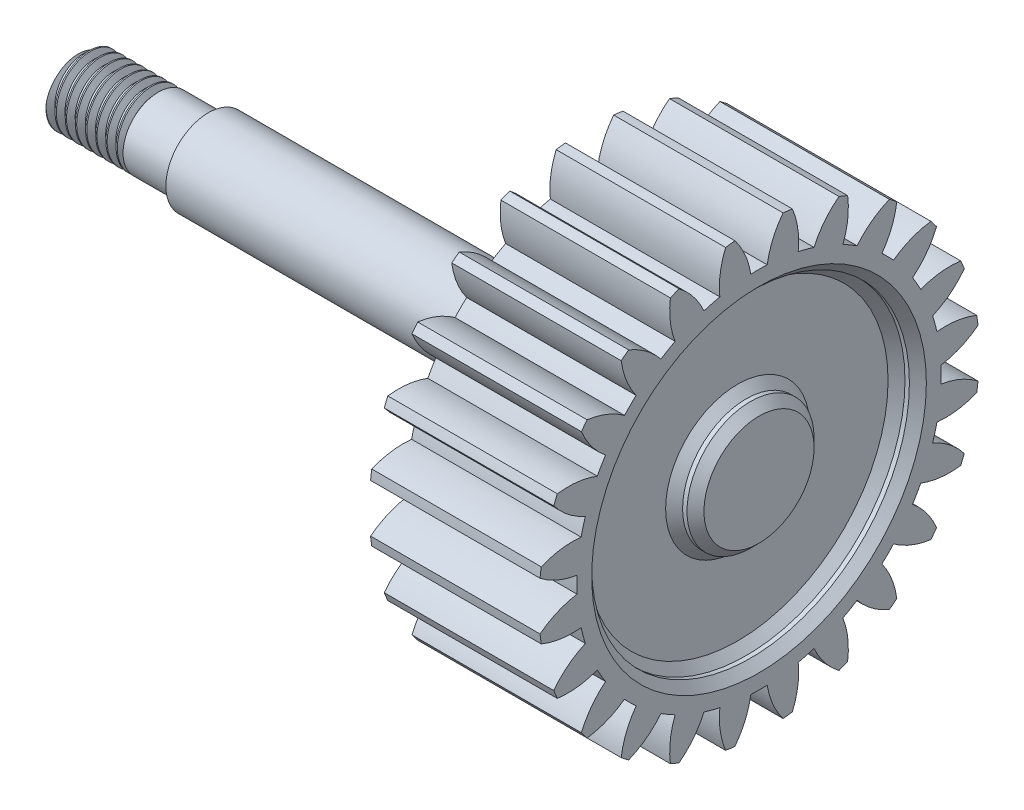
from build123d import *

# Parameters (mm, degrees)
SKETCH1_W                         = 10
SKETCH1_H                         = 13
CUT_EXTRUDE1_DEPTH                = 24.918025574
CUT_EXTRUDE2_DEPTH                = 24.918025574
CUT_EXTRUDE3_DEPTH                = 24.918025574
CUT_EXTRUDE4_DEPTH                = 24.918025574
CUT_EXTRUDE5_DEPTH                = 24.918025574
CUT_EXTRUDE6_DEPTH                = 24.918025574
CUT_EXTRUDE7_DEPTH                = 24.918025574
CUT_EXTRUDE8_DEPTH                = 24.918025574
CUT_EXTRUDE9_DEPTH                = 24.918025574
CUT_EXTRUDE10_DEPTH               = 24.918025574
CUT_EXTRUDE11_DEPTH               = 24.918025574
CUT_EXTRUDE12_DEPTH               = 24.918025574
CUT_EXTRUDE13_DEPTH               = 24.918025574
CUT_EXTRUDE14_DEPTH               = 24.868127435
CUT_EXTRUDE15_DEPTH               = 24.868127435
CUT_EXTRUDE16_DEPTH               = 24.868127435
CUT_EXTRUDE17_DEPTH               = 24.868127435
CUT_EXTRUDE18_DEPTH               = 24.868127435
CUT_EXTRUDE19_DEPTH               = 24.868127435
CUT_EXTRUDE20_DEPTH               = 24.817762377
CUT_EXTRUDE21_DEPTH               = 24.817762377
CUT_EXTRUDE22_DEPTH               = 24.817762377
CUT_EXTRUDE23_DEPTH               = 24.817762377
CUT_EXTRUDE24_DEPTH               = 24.817762377
TAP_DRILL_FOR_M18_HELICOIL1_D     = 18.75
TAP_DRILL_FOR_M18_HELICOIL1_DEPTH = 1.260067876
SKETCH28_W                        = 1.260067876
SKETCH28_H                        = 3.75
SKETCH29_W                        = 30.0000508
SKETCH29_H                        = 2.5
F_0_8_0_8_DIAMETER_HOLE1_D        = 0.8
BOSS_EXTRUDE1_START               = -40.0000508
SKETCH33_R                        = 0.4
BOSS_EXTRUDE1_DEPTH               = 40.0000508
SKETCH35_R                        = 9.375
SKETCH35_R_2                      = 3.75
CUT_EXTRUDE26_DEPTH               = 1.5
CHAMFER1_SIZE                     = 0.5
SKETCH38_R                        = 2.5
SKETCH38_R_2                      = 1.75
CUT_EXTRUDE_THIN1_DEPTH           = 7.5
THREAD1_PITCH                     = 0.6
BOSS_EXTRUDE2_START               = 2.95
SKETCH43_R                        = 2.075
SKETCH43_R_2                      = 1.75
BOSS_EXTRUDE2_DEPTH               = 2.95
CUT_EXTRUDE28_DEPTH               = 1


with BuildPart() as part:
    # Sketch1 → Revolve1 (revolve)
    with BuildSketch(Plane(origin=(0, 0, -2.308091591), x_dir=(-1, 0, 0), z_dir=(0, 0, -1)), mode=Mode.PRIVATE) as revolve1_sk:
        with Locations((-16.260067876, 8.918634156)):
            Rectangle(SKETCH1_W, SKETCH1_H)
    revolve(revolve1_sk.sketch.rotate(Axis((21.260067876, 2.418634156, -2.308091591), (-1, 0, 0)), 270), axis=Axis((21.260067876, 2.418634156, -2.308091591), (-1, 0, 0)))

    # Sketch2 → Cut-Extrude1 (cut, through all)
    with BuildSketch(Plane.ZY.offset(-11.260067876)):
        with BuildLine():
            ThreePointArc((10.613827588, 0.995958952), (10.691908409, 2.418634156), (10.613827588, 3.841309359))
            ThreePointArc((10.613827588, 3.841309359), (9.580993275, 3.234366374), (8.430031088, 2.90208254))
            ThreePointArc((8.430031088, 2.90208254), (8.440908409, 2.418634156), (8.430031088, 1.935185771))
            ThreePointArc((8.430031088, 1.935185771), (9.580993275, 1.602901937), (10.613827588, 0.995958952))
        make_face()
    extrude(amount=-CUT_EXTRUDE1_DEPTH, mode=Mode.SUBTRACT)

    # Sketch3 → Cut-Extrude2 (cut, through all)
    with BuildSketch(Plane.ZY.offset(-11.260067876)):
        with BuildLine():
            ThreePointArc((9.805308431, -2.300003349), (10.248944151, -0.946013431), (10.541739307, 0.448394095))
            ThreePointArc((10.541739307, 0.448394095), (9.387009566, 0.129449381), (8.189264079, 0.106378778))
            ThreePointArc((8.189264079, 0.106378778), (8.074645116, -0.36341176), (7.939012781, -0.827571782))
            ThreePointArc((7.939012781, -0.827571782), (8.964755498, -1.446424254), (9.805308431, -2.300003349))
        make_face()
    extrude(amount=-CUT_EXTRUDE2_DEPTH, mode=Mode.SUBTRACT)

    # Sketch4 → Cut-Extrude3 (cut, through all)
    with BuildSketch(Plane.ZY.offset(-11.260067876)):
        with BuildLine():
            ThreePointArc((8.171281082, -5.274398302), (8.950238658, -4.081365844), (9.593956286, -2.810252566))
            ThreePointArc((9.593956286, -2.810252566), (8.39602404, -2.819463453), (7.23311963, -2.531748602))
            ThreePointArc((7.23311963, -2.531748602), (7.000815474, -2.955865844), (6.749671245, -3.369105766))
            ThreePointArc((6.749671245, -3.369105766), (7.580291822, -4.232353102), (8.171281082, -5.274398302))
        make_face()
    extrude(amount=-CUT_EXTRUDE3_DEPTH, mode=Mode.SUBTRACT)

    # Sketch5 → Cut-Extrude4 (cut, through all)
    with BuildSketch(Plane.ZY.offset(-11.260067876)):
        with BuildLine():
            ThreePointArc((5.823101802, -7.724525806), (6.884296565, -6.773754), (7.83506837, -5.712559238))
            ThreePointArc((7.83506837, -5.712559238), (6.675570724, -5.411408592), (5.626757403, -4.832515577))
            ThreePointArc((5.626757403, -4.832515577), (5.2925992, -5.182056635), (4.943058141, -5.516214839))
            ThreePointArc((4.943058141, -5.516214839), (5.521951157, -6.565028159), (5.823101802, -7.724525806))
        make_face()
    extrude(amount=-CUT_EXTRUDE4_DEPTH, mode=Mode.SUBTRACT)

    # Sketch6 → Cut-Extrude5 (cut, through all)
    with BuildSketch(Plane.ZY.offset(-11.260067876)):
        with BuildLine():
            ThreePointArc((2.920795131, -9.483413721), (4.191908409, -8.839696094), (5.384940866, -8.060738517))
            ThreePointArc((5.384940866, -8.060738517), (4.342895666, -7.469749257), (3.479648331, -6.639128681))
            ThreePointArc((3.479648331, -6.639128681), (3.066408409, -6.89027291), (2.642291166, -7.122577065))
            ThreePointArc((2.642291166, -7.122577065), (2.930006018, -8.285481476), (2.920795131, -9.483413721))
        make_face()
    extrude(amount=-CUT_EXTRUDE5_DEPTH, mode=Mode.SUBTRACT)

    # Sketch7 → Cut-Extrude6 (cut, through all)
    with BuildSketch(Plane.ZY.offset(-11.260067876)):
        with BuildLine():
            ThreePointArc((-0.33785153, -10.431196742), (1.056555995, -10.138401586), (2.410545914, -9.694765867))
            ThreePointArc((2.410545914, -9.694765867), (1.556966819, -8.854212934), (0.938114347, -7.828470216))
            ThreePointArc((0.938114347, -7.828470216), (0.473954325, -7.964102551), (0.004163787, -8.078721515))
            ThreePointArc((0.004163787, -8.078721515), (-0.018906816, -9.276467002), (-0.33785153, -10.431196742))
        make_face()
    extrude(amount=-CUT_EXTRUDE6_DEPTH, mode=Mode.SUBTRACT)

    # Sketch8 → Cut-Extrude7 (cut, through all)
    with BuildSketch(Plane.ZY.offset(-11.260067876)):
        with BuildLine():
            ThreePointArc((-3.730766795, -10.503285023), (-2.308091591, -10.581365844), (-0.885416387, -10.503285023))
            ThreePointArc((-0.885416387, -10.503285023), (-1.492359372, -9.470450711), (-1.824643207, -8.319488523))
            ThreePointArc((-1.824643207, -8.319488523), (-2.308091591, -8.330365844), (-2.791539975, -8.319488523))
            ThreePointArc((-2.791539975, -8.319488523), (-3.12382381, -9.470450711), (-3.730766795, -10.503285023))
        make_face()
    extrude(amount=-CUT_EXTRUDE7_DEPTH, mode=Mode.SUBTRACT)

    # Sketch9 → Cut-Extrude8 (cut, through all)
    with BuildSketch(Plane.ZY.offset(-11.260067876)):
        with BuildLine():
            ThreePointArc((-7.026729096, -9.694765867), (-5.672739177, -10.138401586), (-4.278331652, -10.431196742))
            ThreePointArc((-4.278331652, -10.431196742), (-4.597276366, -9.276467002), (-4.620346969, -8.078721515))
            ThreePointArc((-4.620346969, -8.078721515), (-5.090137507, -7.964102551), (-5.554297529, -7.828470216))
            ThreePointArc((-5.554297529, -7.828470216), (-6.173150001, -8.854212934), (-7.026729096, -9.694765867))
        make_face()
    extrude(amount=-CUT_EXTRUDE8_DEPTH, mode=Mode.SUBTRACT)

    # Sketch10 → Cut-Extrude9 (cut, through all)
    with BuildSketch(Plane.ZY.offset(-11.260067876)):
        with BuildLine():
            ThreePointArc((-10.001124048, -8.060738517), (-8.808091591, -8.839696094), (-7.536978312, -9.483413721))
            ThreePointArc((-7.536978312, -9.483413721), (-7.5461892, -8.285481476), (-7.258474348, -7.122577065))
            ThreePointArc((-7.258474348, -7.122577065), (-7.682591591, -6.89027291), (-8.095831512, -6.639128681))
            ThreePointArc((-8.095831512, -6.639128681), (-8.959078848, -7.469749257), (-10.001124048, -8.060738517))
        make_face()
    extrude(amount=-CUT_EXTRUDE9_DEPTH, mode=Mode.SUBTRACT)

    # Sketch11 → Cut-Extrude10 (cut, through all)
    with BuildSketch(Plane.ZY.offset(-11.260067876)):
        with BuildLine():
            ThreePointArc((-12.451251552, -5.712559238), (-11.500479746, -6.773754), (-10.439284984, -7.724525806))
            ThreePointArc((-10.439284984, -7.724525806), (-10.138134338, -6.565028159), (-9.559241323, -5.516214839))
            ThreePointArc((-9.559241323, -5.516214839), (-9.908782382, -5.182056635), (-10.242940585, -4.832515577))
            ThreePointArc((-10.242940585, -4.832515577), (-11.291753906, -5.411408592), (-12.451251552, -5.712559238))
        make_face()
    extrude(amount=-CUT_EXTRUDE10_DEPTH, mode=Mode.SUBTRACT)

    # Sketch12 → Cut-Extrude11 (cut, through all)
    with BuildSketch(Plane.ZY.offset(-11.260067876)):
        with BuildLine():
            ThreePointArc((-14.210139467, -2.810252566), (-13.56642184, -4.081365844), (-12.787464263, -5.274398302))
            ThreePointArc((-12.787464263, -5.274398302), (-12.196475003, -4.232353102), (-11.365854427, -3.369105766))
            ThreePointArc((-11.365854427, -3.369105766), (-11.616998656, -2.955865844), (-11.849302812, -2.531748602))
            ThreePointArc((-11.849302812, -2.531748602), (-13.012207222, -2.819463453), (-14.210139467, -2.810252566))
        make_face()
    extrude(amount=-CUT_EXTRUDE11_DEPTH, mode=Mode.SUBTRACT)

    # Sketch13 → Cut-Extrude12 (cut, through all)
    with BuildSketch(Plane.ZY.offset(-11.260067876)):
        with BuildLine():
            ThreePointArc((-15.157922489, 0.448394095), (-14.865127333, -0.946013431), (-14.421491613, -2.300003349))
            ThreePointArc((-14.421491613, -2.300003349), (-13.58093868, -1.446424254), (-12.555195963, -0.827571782))
            ThreePointArc((-12.555195963, -0.827571782), (-12.690828298, -0.36341176), (-12.805447261, 0.106378778))
            ThreePointArc((-12.805447261, 0.106378778), (-14.003192748, 0.129449381), (-15.157922489, 0.448394095))
        make_face()
    extrude(amount=-CUT_EXTRUDE12_DEPTH, mode=Mode.SUBTRACT)

    # Sketch14 → Cut-Extrude13 (cut, through all)
    with BuildSketch(Plane.ZY.offset(-11.260067876)):
        with BuildLine():
            ThreePointArc((-15.23001077, 3.841309359), (-15.308091591, 2.418634156), (-15.23001077, 0.995958952))
            ThreePointArc((-15.23001077, 0.995958952), (-14.197176457, 1.602901937), (-13.046214269, 1.935185771))
            ThreePointArc((-13.046214269, 1.935185771), (-13.057091591, 2.418634156), (-13.046214269, 2.90208254))
            ThreePointArc((-13.046214269, 2.90208254), (-14.197176457, 3.234366374), (-15.23001077, 3.841309359))
        make_face()
    extrude(amount=-CUT_EXTRUDE13_DEPTH, mode=Mode.SUBTRACT)

    # Sketch15 → Cut-Extrude14 (cut, through all)
    with BuildSketch(Plane.ZY.offset(-11.260067876)):
        with BuildLine():
            ThreePointArc((-14.421491613, 7.13727166), (-14.865127333, 5.783281742), (-15.157922489, 4.388874216))
            ThreePointArc((-15.157922489, 4.388874216), (-14.003192748, 4.70781893), (-12.805447261, 4.730889533))
            ThreePointArc((-12.805447261, 4.730889533), (-12.690828298, 5.200680071), (-12.555195963, 5.664840093))
            ThreePointArc((-12.555195963, 5.664840093), (-13.58093868, 6.283692565), (-14.421491613, 7.13727166))
        make_face()
    extrude(amount=-CUT_EXTRUDE14_DEPTH, mode=Mode.SUBTRACT)

    # Sketch16 → Cut-Extrude15 (cut, through all)
    with BuildSketch(Plane.ZY.offset(-11.260067876)):
        with BuildLine():
            ThreePointArc((-12.787464263, 10.111666613), (-13.56642184, 8.918634156), (-14.210139467, 7.647520877))
            ThreePointArc((-14.210139467, 7.647520877), (-13.012207222, 7.656731764), (-11.849302812, 7.369016913))
            ThreePointArc((-11.849302812, 7.369016913), (-11.616998656, 7.793134156), (-11.365854427, 8.206374077))
            ThreePointArc((-11.365854427, 8.206374077), (-12.196475003, 9.069621413), (-12.787464263, 10.111666613))
        make_face()
    extrude(amount=-CUT_EXTRUDE15_DEPTH, mode=Mode.SUBTRACT)

    # Sketch17 → Cut-Extrude16 (cut, through all)
    with BuildSketch(Plane.ZY.offset(-11.260067876)):
        with BuildLine():
            ThreePointArc((-10.439284984, 12.561794117), (-11.500479746, 11.611022311), (-12.451251552, 10.549827549))
            ThreePointArc((-12.451251552, 10.549827549), (-11.291753906, 10.248676903), (-10.242940585, 9.669783888))
            ThreePointArc((-10.242940585, 9.669783888), (-9.908782382, 10.019324946), (-9.559241323, 10.35348315))
            ThreePointArc((-9.559241323, 10.35348315), (-10.138134338, 11.40229647), (-10.439284984, 12.561794117))
        make_face()
    extrude(amount=-CUT_EXTRUDE16_DEPTH, mode=Mode.SUBTRACT)

    # Sketch18 → Cut-Extrude17 (cut, through all)
    with BuildSketch(Plane.ZY.offset(-11.260067876)):
        with BuildLine():
            ThreePointArc((-7.536978312, 14.320682032), (-8.808091591, 13.676964405), (-10.001124048, 12.898006828))
            ThreePointArc((-10.001124048, 12.898006828), (-8.959078848, 12.307017568), (-8.095831512, 11.476396992))
            ThreePointArc((-8.095831512, 11.476396992), (-7.682591591, 11.727541221), (-7.258474348, 11.959845376))
            ThreePointArc((-7.258474348, 11.959845376), (-7.5461892, 13.122749787), (-7.536978312, 14.320682032))
        make_face()
    extrude(amount=-CUT_EXTRUDE17_DEPTH, mode=Mode.SUBTRACT)

    # Sketch19 → Cut-Extrude18 (cut, through all)
    with BuildSketch(Plane.ZY.offset(-11.260067876)):
        with BuildLine():
            ThreePointArc((-4.278331652, 15.268465053), (-5.672739177, 14.975669897), (-7.026729096, 14.532034178))
            ThreePointArc((-7.026729096, 14.532034178), (-6.173150001, 13.691481245), (-5.554297529, 12.665738527))
            ThreePointArc((-5.554297529, 12.665738527), (-5.090137507, 12.801370862), (-4.620346969, 12.915989826))
            ThreePointArc((-4.620346969, 12.915989826), (-4.597276366, 14.113735313), (-4.278331652, 15.268465053))
        make_face()
    extrude(amount=-CUT_EXTRUDE18_DEPTH, mode=Mode.SUBTRACT)

    # Sketch20 → Cut-Extrude19 (cut, through all)
    with BuildSketch(Plane.ZY.offset(-11.260067876)):
        with BuildLine():
            ThreePointArc((-0.885416387, 15.340553334), (-2.308091591, 15.418634156), (-3.730766795, 15.340553334))
            ThreePointArc((-3.730766795, 15.340553334), (-3.12382381, 14.307719022), (-2.791539975, 13.156756834))
            ThreePointArc((-2.791539975, 13.156756834), (-2.308091591, 13.167634156), (-1.824643207, 13.156756834))
            ThreePointArc((-1.824643207, 13.156756834), (-1.492359372, 14.307719022), (-0.885416387, 15.340553334))
        make_face()
    extrude(amount=-CUT_EXTRUDE19_DEPTH, mode=Mode.SUBTRACT)

    # Sketch21 → Cut-Extrude20 (cut, through all)
    with BuildSketch(Plane.ZY.offset(-11.260067876)):
        with BuildLine():
            ThreePointArc((2.410545914, 14.532034178), (1.056555995, 14.975669897), (-0.33785153, 15.268465053))
            ThreePointArc((-0.33785153, 15.268465053), (-0.018906816, 14.113735313), (0.004163787, 12.915989826))
            ThreePointArc((0.004163787, 12.915989826), (0.473954325, 12.801370862), (0.938114347, 12.665738527))
            ThreePointArc((0.938114347, 12.665738527), (1.556966819, 13.691481245), (2.410545914, 14.532034178))
        make_face()
    extrude(amount=-CUT_EXTRUDE20_DEPTH, mode=Mode.SUBTRACT)

    # Sketch22 → Cut-Extrude21 (cut, through all)
    with BuildSketch(Plane.ZY.offset(-11.260067876)):
        with BuildLine():
            ThreePointArc((5.384940866, 12.898006828), (4.191908409, 13.676964405), (2.920795131, 14.320682032))
            ThreePointArc((2.920795131, 14.320682032), (2.930006018, 13.122749787), (2.642291166, 11.959845376))
            ThreePointArc((2.642291166, 11.959845376), (3.066408409, 11.727541221), (3.479648331, 11.476396992))
            ThreePointArc((3.479648331, 11.476396992), (4.342895666, 12.307017568), (5.384940866, 12.898006828))
        make_face()
    extrude(amount=-CUT_EXTRUDE21_DEPTH, mode=Mode.SUBTRACT)

    # Sketch23 → Cut-Extrude22 (cut, through all)
    with BuildSketch(Plane.ZY.offset(-11.260067876)):
        with BuildLine():
            ThreePointArc((7.83506837, 10.549827549), (6.884296565, 11.611022311), (5.823101802, 12.561794117))
            ThreePointArc((5.823101802, 12.561794117), (5.521951157, 11.40229647), (4.943058141, 10.35348315))
            ThreePointArc((4.943058141, 10.35348315), (5.2925992, 10.019324946), (5.626757403, 9.669783888))
            ThreePointArc((5.626757403, 9.669783888), (6.675570724, 10.248676903), (7.83506837, 10.549827549))
        make_face()
    extrude(amount=-CUT_EXTRUDE22_DEPTH, mode=Mode.SUBTRACT)

    # Sketch24 → Cut-Extrude23 (cut, through all)
    with BuildSketch(Plane.ZY.offset(-11.260067876)):
        with BuildLine():
            ThreePointArc((9.593956286, 7.647520877), (8.950238658, 8.918634156), (8.171281082, 10.111666613))
            ThreePointArc((8.171281082, 10.111666613), (7.580291822, 9.069621413), (6.749671245, 8.206374077))
            ThreePointArc((6.749671245, 8.206374077), (7.000815474, 7.793134156), (7.23311963, 7.369016913))
            ThreePointArc((7.23311963, 7.369016913), (8.39602404, 7.656731764), (9.593956286, 7.647520877))
        make_face()
    extrude(amount=-CUT_EXTRUDE23_DEPTH, mode=Mode.SUBTRACT)

    # Sketch25 → Cut-Extrude24 (cut, through all)
    with BuildSketch(Plane.ZY.offset(-11.260067876)):
        with BuildLine():
            ThreePointArc((10.541739307, 4.388874216), (10.248944151, 5.783281742), (9.805308431, 7.13727166))
            ThreePointArc((9.805308431, 7.13727166), (8.964755498, 6.283692565), (7.939012781, 5.664840093))
            ThreePointArc((7.939012781, 5.664840093), (8.074645116, 5.200680071), (8.189264079, 4.730889533))
            ThreePointArc((8.189264079, 4.730889533), (9.387009566, 4.70781893), (10.541739307, 4.388874216))
        make_face()
    extrude(amount=-CUT_EXTRUDE24_DEPTH, mode=Mode.SUBTRACT)

    # Tap Drill for M18 Helicoil1
    with Locations(Plane(origin=(21.260067876, 0, 0), x_dir=(0, 0, -1), z_dir=(1, 0, 0))):
        with Locations((2.308091591, 2.418634156)):
            Hole(TAP_DRILL_FOR_M18_HELICOIL1_D / 2, depth=TAP_DRILL_FOR_M18_HELICOIL1_DEPTH)

    # Sketch28 → Revolve2 (revolve)
    with BuildSketch(Plane.XY.offset(-2.308091591), mode=Mode.PRIVATE) as revolve2_sk:
        with Locations((20.630033938, 4.293634156)):
            Rectangle(SKETCH28_W, SKETCH28_H)
    revolve(revolve2_sk.sketch.rotate(Axis((20, 2.418634156, -2.308091591), (1, 0, 0)), 270), axis=Axis((20, 2.418634156, -2.308091591), (1, 0, 0)))

    # Sketch29 → Revolve3 (revolve)
    with BuildSketch(Plane.XY.offset(-2.308091591), mode=Mode.PRIVATE) as revolve3_sk:
        with Locations((-3.739957524, 3.668634156)):
            Rectangle(SKETCH29_W, SKETCH29_H)
    revolve(revolve3_sk.sketch.rotate(Axis((-18.739982924, 2.418634156, -2.308091591), (1, 0, 0)), 270), axis=Axis((-18.739982924, 2.418634156, -2.308091591), (1, 0, 0)))

    # Ø0.8 (0.8) Diameter Hole1 (through all)
    with Locations(Plane(origin=(21.260067876, 0, 0), x_dir=(0, 0, -1), z_dir=(1, 0, 0))):
        with Locations((2.308091591, 2.418634156)):
            Hole(F_0_8_0_8_DIAMETER_HOLE1_D / 2)

    # Sketch33 → Boss-Extrude1 (add)
    with BuildSketch(Plane(origin=(21.260067876, 0, 0), x_dir=(0, 0, -1), z_dir=(1, 0, 0)).offset(BOSS_EXTRUDE1_START)):
        with Locations((2.308091591, 2.418634156)):
            Circle(SKETCH33_R)
    extrude(amount=BOSS_EXTRUDE1_DEPTH)

    # Sketch35 → Cut-Extrude26 (cut)
    with BuildSketch(Plane.ZY.offset(-11.260067876)):
        with Locations(Location((-2.308091591, 2.418634156, 0), (0, 0, 180))):
            Circle(SKETCH35_R)
        with Locations(Location((-2.308091591, 2.418634156, 0), (0, 0, 180))):
            Circle(SKETCH35_R_2, mode=Mode.SUBTRACT)
    extrude(amount=-CUT_EXTRUDE26_DEPTH, mode=Mode.SUBTRACT)

    # Chamfer1
    chamfer1_edges = [part.edges().sort_by_distance(p)[0] for p in [
        (21.260067876, 2.418634156, -11.683091591),
        (20, 2.418634156, -11.683091591),
        (20, 2.418634156, 1.441908409),
        (21.260067876, 2.418634156, 1.441908409),
        (11.260067876, 2.418634156, 0.191908409),
        (11.260067876, 2.418634156, 1.441908409),
        (12.760067876, 2.418634156, 7.066908409),
        (12.760067876, 2.418634156, 1.441908409),
        (11.260067876, 2.418634156, 7.066908409),
    ]]
    chamfer(chamfer1_edges, length=CHAMFER1_SIZE)

    # Sketch38 → Cut-Extrude-Thin1 (cut)
    with BuildSketch(Plane.ZY.offset(18.739982924)):
        with Locations((-2.308091591, 2.418634156)):
            Circle(SKETCH38_R)
        with Locations((-2.308091591, 2.418634156)):
            Circle(SKETCH38_R_2, mode=Mode.SUBTRACT)
    extrude(amount=-CUT_EXTRUDE_THIN1_DEPTH, mode=Mode.SUBTRACT)

    # Thread1: arcs per turn and ends read off the stored shape
    # Thread1: the profile of Thread Profile1 profile screwed along a right-hand helix through 8.333333 turns, 6 arcs to a turn; built about Z, then put on its axis
    thread1_z = Axis((0, 0, 0), (0, 0, 1))
    thread1_corners = [(1.7497, 0, -0.000173205), (2.074759525, 0, 0.1875), (2.074759525, 0, 0.2625), (1.7497, 0, 0.450173204)]
    with BuildLine(mode=Mode.PRIVATE) as thread1_profile:
        Line(thread1_corners[0], thread1_corners[1])
        Line(thread1_corners[1], thread1_corners[2])
        Line(thread1_corners[2], thread1_corners[3])
        Line(thread1_corners[3], thread1_corners[0])
    thread1_cap = Face(thread1_profile.wire())
    thread1_turn_angles = [0, 30, 60, 90, 120, 150, 180, 210, 240, 270, 300, 330, 360]
    thread1_turn_weights = [1, 0.8660254037844387, 1, 0.8660254037844387, 1, 0.8660254037844387, 1, 0.8660254037844387, 1, 0.8660254037844387, 1, 0.8660254037844387, 1]
    thread1_turn_rails = [Edge.make_bspline([Vector(p[0], p[1], 0).rotate(thread1_z, thread1_turn_angles[k]) / thread1_turn_weights[k] + Vector(0, 0, p[2] + THREAD1_PITCH * thread1_turn_angles[k] / 360) for k in range(13)], [0, 0, 0, 1, 1, 2, 2, 3, 3, 4, 4, 5, 5, 6, 6, 6], 2, thread1_turn_weights) for p in thread1_corners]
    thread1_turn_sides = [Face.make_surface_from_curves(thread1_turn_rails[p[0]], thread1_turn_rails[p[1]]) for p in [(0, 1), (1, 2), (2, 3), (3, 0)]]
    thread1_last_angles = [2880, 2910, 2940, 2970, 3000]
    thread1_last_weights = [1, 0.8660254037844387, 1, 0.8660254037844406, 1]
    thread1_last_rails = [Edge.make_bspline([Vector(p[0], p[1], 0).rotate(thread1_z, thread1_last_angles[k]) / thread1_last_weights[k] + Vector(0, 0, p[2] + THREAD1_PITCH * thread1_last_angles[k] / 360) for k in range(5)], [0, 0, 0, 1, 1, 2, 2, 2], 2, thread1_last_weights) for p in thread1_corners]
    thread1_last_sides = [Face.make_surface_from_curves(thread1_last_rails[p[0]], thread1_last_rails[p[1]]) for p in [(0, 1), (1, 2), (2, 3), (3, 0)]]
    thread1 = Plane(origin=(-13.739982924, 2.418634156, -2.308091591), x_dir=(0, 0, 1), z_dir=(-1, 0, 0)) * Solid(Shell([*[p.moved(Location((0, 0, THREAD1_PITCH * i))) for i in range(8) for p in thread1_turn_sides], *thread1_last_sides, thread1_cap, thread1_cap.rotate(thread1_z, 3000).moved(Location((0, 0, THREAD1_PITCH * 3000 / 360)))]))
    add(thread1)

    # Sketch43 → Boss-Extrude2 (add)
    with BuildSketch(Plane.ZY.offset(11.239982924).offset(BOSS_EXTRUDE2_START)):
        with Locations((-2.308091591, 2.418634156)):
            Circle(SKETCH43_R)
        with Locations((-2.308091591, 2.418634156)):
            Circle(SKETCH43_R_2, mode=Mode.SUBTRACT)
    extrude(amount=-BOSS_EXTRUDE2_DEPTH)

    # Cut-Extrude28: read off the stored shape, not the designer's step
    # Cut-Extrude28 outline → Cut-Extrude28 (cut)
    with BuildSketch(Plane.ZY.offset(18.739982924)):
        Polygon((-5, 6), (-5, -1), (1, -1), (1, 6), (-4.375794121, 6), align=None)
    extrude(amount=CUT_EXTRUDE28_DEPTH, mode=Mode.SUBTRACT)


solid = part.part
